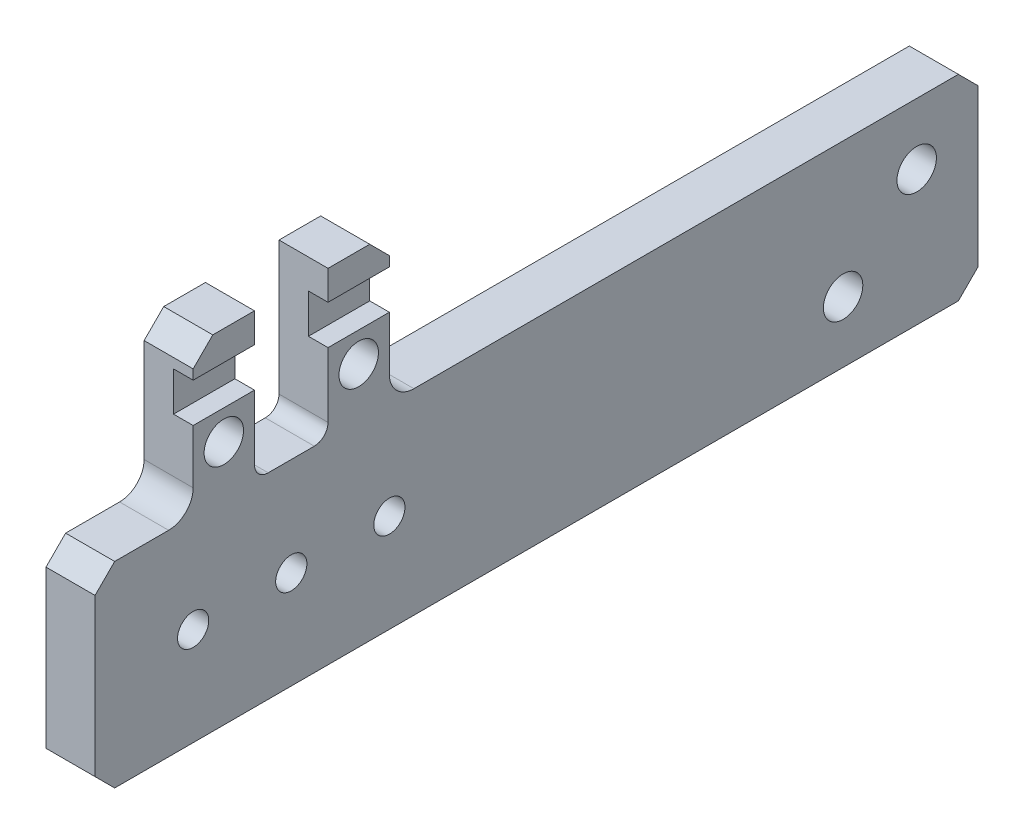
from build123d import *

# Parameters (mm, degrees)
BOSS_EXTRUDE1_DEPTH    = 6.35
F_10_32_TAPPED_HOLE1_D = 4.0386
F_10_CLEARANCE_HOLE1_D = 5.1054
SKETCH6_W              = 25.4
SKETCH6_H              = 5.08
CUT_EXTRUDE1_DEPTH     = 2.54
CHAMFER1_SIZE          = 2.54


with BuildPart() as part:
    # Sketch1 → Boss-Extrude1 (new body)
    with BuildSketch(Plane(origin=(0, 0, 0), x_dir=(0, 0, -1), z_dir=(1, 0, 0))):
        with BuildLine():
            Line((0, 0), (114.3, 0))
            Line((114.3, 0), (114.3, 25.4))
            Line((114.3, 25.4), (41.275, 25.4))
            ThreePointArc((41.275, 25.4), (39.02993597, 26.32993597), (38.1, 28.575))
            Line((38.1, 28.575), (38.1, 44.45))
            Line((38.1, 44.45), (30.1625, 44.45))
            Line((30.1625, 44.45), (30.1625, 27.178))
            ThreePointArc((30.1625, 27.178), (29.641735857, 25.920764143), (28.3845, 25.4))
            Line((28.3845, 25.4), (22.4155, 25.4))
            ThreePointArc((22.4155, 25.4), (21.158264143, 25.920764143), (20.6375, 27.178))
            Line((20.6375, 27.178), (20.6375, 44.45))
            Line((20.6375, 44.45), (12.7, 44.45))
            Line((12.7, 44.45), (12.7, 28.575))
            ThreePointArc((12.7, 28.575), (11.77006403, 26.32993597), (9.525, 25.4))
            Line((9.525, 25.4), (0, 25.4))
            Line((0, 25.4), (0, 0))
        make_face()
    extrude(amount=BOSS_EXTRUDE1_DEPTH)

    # #10-32 Tapped Hole1 (through all)
    with Locations(Plane(origin=(6.35, 0, 0), x_dir=(0, 0, -1), z_dir=(1, 0, 0))):
        with Locations((12.7, 12.7), (25.4, 12.7), (38.1, 12.7)):
            Hole(F_10_32_TAPPED_HOLE1_D / 2)

    # #10 Clearance Hole1 (through all)
    with Locations(Plane(origin=(6.35, 0, 0), x_dir=(0, 0, -1), z_dir=(1, 0, 0))):
        with Locations((106.3625, 17.4625), (96.8375, 7.9375), (34.13125, 31.75), (16.66875, 31.75)):
            Hole(F_10_CLEARANCE_HOLE1_D / 2)

    # Sketch6 → Cut-Extrude1 (cut)
    with BuildSketch(Plane(origin=(6.35, 0, 0), x_dir=(0, 0, -1), z_dir=(1, 0, 0))):
        with Locations((25.4, 38.1)):
            Rectangle(SKETCH6_W, SKETCH6_H)
    extrude(amount=-CUT_EXTRUDE1_DEPTH, mode=Mode.SUBTRACT)

    # Chamfer1
    chamfer1_edges = [part.edges().sort_by_distance(p)[0] for p in [
        (3.175, 44.45, -38.1),
        (3.175, 44.45, -12.7),
        (3.175, 25.4, -114.3),
        (3.175, 0, -114.3),
        (3.175, 0, 0),
        (3.175, 25.4, 0),
    ]]
    chamfer(chamfer1_edges, length=CHAMFER1_SIZE)


solid = part.part
